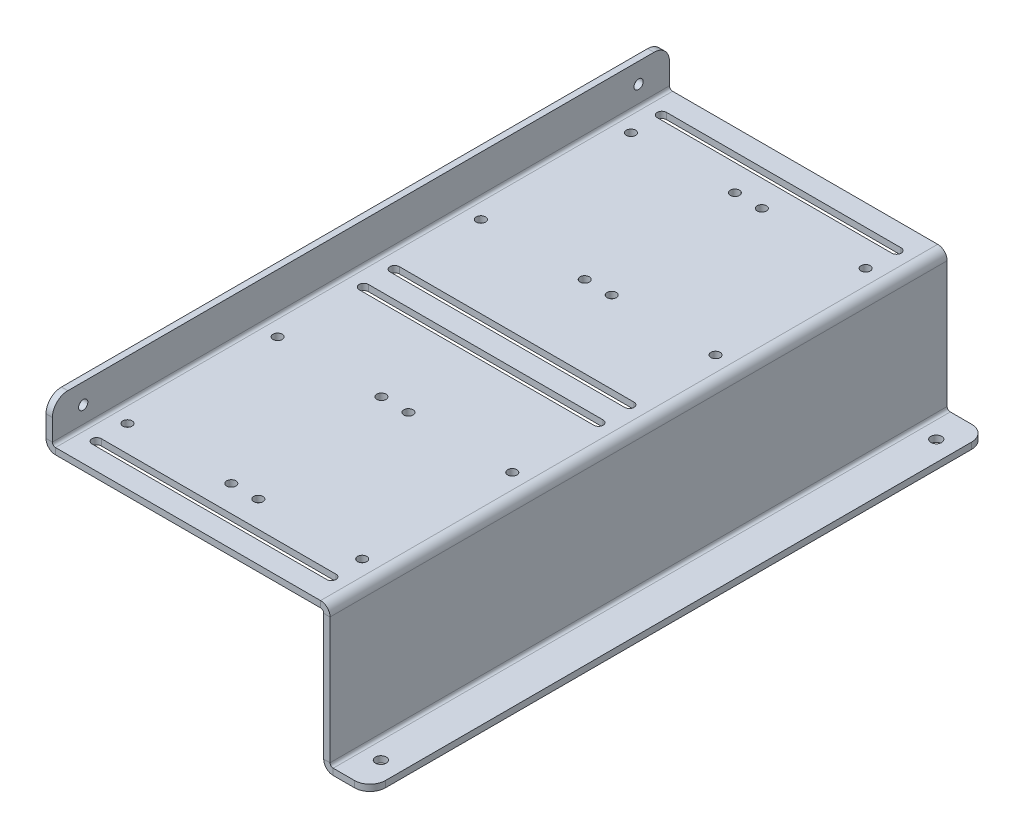
from build123d import *

# Parameters (mm, degrees)
BASE_FLANGE1_DEPTH = 200
SKETCH6_R          = 1.5
CUT_EXTRUDE1_DEPTH = 10
SKETCH7_R          = 1.75
CUT_EXTRUDE2_DEPTH = 10
FILLET1_R          = 5
SKETCH8_R          = 1.5
CUT_EXTRUDE3_DEPTH = 10


# Read off the part's stored shape, not the designer's step: Base-Flange1
with BuildPart() as part:
    # Base-Flange1 outline → Base-Flange1 (new body)
    with BuildSketch(Plane.XY):
        with BuildLine():
            Line((-87.94, 48.076), (-87.94, 60))
            Line((-87.94, 60), (-90, 60))
            Line((-90, 60), (-90, 48.076))
            ThreePointArc((-90, 48.076), (-89.099060459, 45.900939541), (-86.924, 45))
            Line((-86.924, 45), (-1.016, 45))
            ThreePointArc((-1.016, 45), (-0.29757951, 44.70242049), (0, 43.984))
            Line((0, 43.984), (0, 3.076))
            ThreePointArc((0, 3.076), (0.900939541, 0.900939541), (3.076, 0))
            Line((3.076, 0), (15, 0))
            Line((15, 0), (15, 2.06))
            Line((15, 2.06), (3.076, 2.06))
            ThreePointArc((3.076, 2.06), (2.35757951, 2.35757951), (2.06, 3.076))
            Line((2.06, 3.076), (2.06, 43.984))
            ThreePointArc((2.06, 43.984), (1.159060459, 46.159060459), (-1.016, 47.06))
            Line((-1.016, 47.06), (-86.924, 47.06))
            ThreePointArc((-86.924, 47.06), (-87.64242049, 47.35757951), (-87.94, 48.076))
        make_face()
    extrude(amount=BASE_FLANGE1_DEPTH)

    # Sketch6 → Cut-Extrude1 (cut)
    with BuildSketch(Plane(origin=(-87.94, 0, 0), x_dir=(0, 0, -1), z_dir=(1, 0, 0))):
        with Locations((-190, 53.53)):
            Circle(SKETCH6_R)
        with Locations((-10, 53.53)):
            Circle(SKETCH6_R)
    extrude(amount=-CUT_EXTRUDE1_DEPTH, mode=Mode.SUBTRACT)

    # Sketch7 → Cut-Extrude2 (cut)
    with BuildSketch(Plane(origin=(0, 2.06, 0), x_dir=(1, 0, 0), z_dir=(0, 1, 0))):
        with Locations(Location((8.53, -10, 0), (0, 0, 270))):
            Circle(SKETCH7_R)
        with Locations(Location((8.53, -190, 0), (0, 0, 270))):
            Circle(SKETCH7_R)
    extrude(amount=-CUT_EXTRUDE2_DEPTH, mode=Mode.SUBTRACT)

    # Fillet1
    fillet1_edges = [part.edges().sort_by_distance(p)[0] for p in [
        (15, 1.03, 0),
        (-88.97, 60, 0),
        (15, 1.03, 200),
        (-88.97, 60, 200),
    ]]
    fillet(fillet1_edges, radius=FILLET1_R)

    # Sketch8 → Cut-Extrude3 (cut)
    with BuildSketch(Plane(origin=(0, 47.06, 0), x_dir=(1, 0, 0), z_dir=(0, 1, 0))):
        with Locations(Location((-82, -181.59, 0), (0, 0, 180))):
            Circle(SKETCH8_R)
        with Locations(Location((-48.35, -181.59, 0), (0, 0, 180))):
            Circle(SKETCH8_R)
        with Locations(Location((-48.35, -132.94, 0), (0, 0, 180))):
            Circle(SKETCH8_R)
        with Locations(Location((-82, -132.94, 0), (0, 0, 180))):
            Circle(SKETCH8_R)
        with Locations((-5.94, -132.94)):
            Circle(SKETCH8_R)
        with Locations((-39.59, -132.94)):
            Circle(SKETCH8_R)
        with Locations((-39.59, -181.59)):
            Circle(SKETCH8_R)
        with Locations((-5.94, -181.59)):
            Circle(SKETCH8_R)
        with Locations(Location((-5.94, -18.41, 0), (0, 0, 180))):
            Circle(SKETCH8_R)
        with Locations(Location((-39.59, -18.41, 0), (0, 0, 180))):
            Circle(SKETCH8_R)
        with Locations(Location((-39.59, -67.06, 0), (0, 0, 180))):
            Circle(SKETCH8_R)
        with Locations(Location((-5.94, -67.06, 0), (0, 0, 180))):
            Circle(SKETCH8_R)
        with Locations((-82, -67.06)):
            Circle(SKETCH8_R)
        with Locations((-48.35, -67.06)):
            Circle(SKETCH8_R)
        with Locations((-48.35, -18.41)):
            Circle(SKETCH8_R)
        with Locations((-82, -18.41)):
            Circle(SKETCH8_R)
        with BuildLine():
            Line((-82, -190.09), (-5.94, -190.09))
            ThreePointArc((-5.94, -190.09), (-4.44, -191.59), (-5.94, -193.09))
            Line((-5.94, -193.09), (-82, -193.09))
            ThreePointArc((-82, -193.09), (-83.5, -191.59), (-82, -190.09))
        make_face()
        with BuildLine():
            Line((-82, -9.91), (-5.94, -9.91))
            ThreePointArc((-5.94, -9.91), (-4.44, -8.41), (-5.94, -6.91))
            Line((-5.94, -6.91), (-82, -6.91))
            ThreePointArc((-82, -6.91), (-83.5, -8.41), (-82, -9.91))
        make_face()
        with BuildLine():
            Line((-82, -103.5), (-5.94, -103.5))
            ThreePointArc((-5.94, -103.5), (-4.44, -105), (-5.94, -106.5))
            Line((-5.94, -106.5), (-82, -106.5))
            ThreePointArc((-82, -106.5), (-83.5, -105), (-82, -103.5))
        make_face()
        with BuildLine():
            Line((-82, -96.5), (-5.94, -96.5))
            ThreePointArc((-5.94, -96.5), (-4.44, -95), (-5.94, -93.5))
            Line((-5.94, -93.5), (-82, -93.5))
            ThreePointArc((-82, -93.5), (-83.5, -95), (-82, -96.5))
        make_face()
    extrude(amount=-CUT_EXTRUDE3_DEPTH, mode=Mode.SUBTRACT)


solid = part.part
